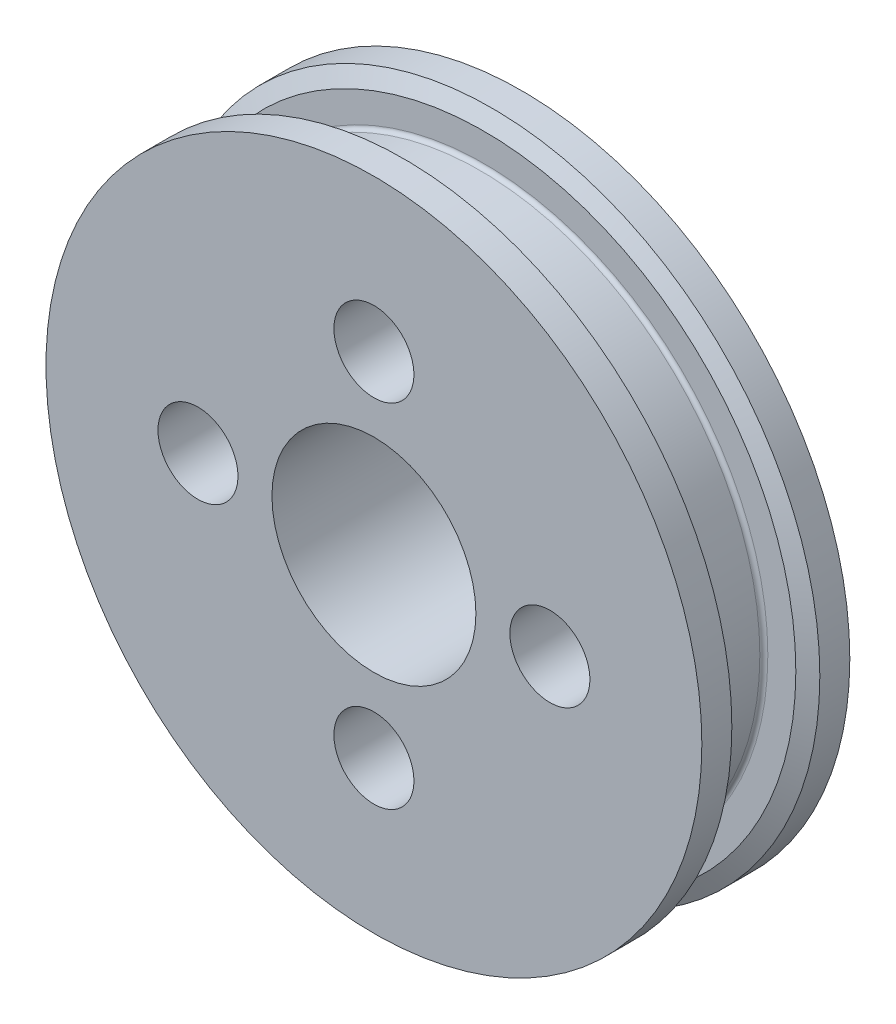
from build123d import *

# Parameters (mm, degrees)
SKETCH3_W               = 16.51
SKETCH3_H               = 16.51
SKETCH3_R               = 6.477
BOSS_EXTRUDE1_DEPTH     = 3.175
CUT_EXTRUDE1_DEPTH      = 31.918175431
CUT_EXTRUDE1_DEPTH_BACK = 31.918175431
SKETCH4_R               = 2.54
FILLET1_R               = 0.254


with BuildPart() as part:
    # Sketch2 → Revolve1 (revolve)
    with BuildSketch(Plane(origin=(0, 0, 0), x_dir=(0, 0, -1), z_dir=(1, 0, 0))):
        Polygon((0, 6.477), (0, 20.828), (1.905, 20.828), (2.413, 19.812), (2.413, 17.78), (6.985, 17.78), (6.985, 19.812), (7.493, 20.828), (9.398, 20.828), (9.398, 6.477), align=None)
    revolve(axis=Axis((0, 0, 0), (0, 0, -1)))

    # Sketch3 → Boss-Extrude1 (add)
    with BuildSketch(Plane(origin=(0, 0, -9.398), x_dir=(-1, 0, 0), z_dir=(0, 0, -1))):
        Rectangle(SKETCH3_W, SKETCH3_H)
        Circle(SKETCH3_R, mode=Mode.SUBTRACT)
    extrude(amount=BOSS_EXTRUDE1_DEPTH)

    # Sketch4 → Cut-Extrude1 (cut, two sides: drawn at the far end of the back side and taken through both)
    with BuildSketch(Plane(origin=(0, 0, -9.398), x_dir=(-1, 0, 0), z_dir=(0, 0, -1)).offset(-CUT_EXTRUDE1_DEPTH_BACK)):
        with Locations((0, 11.176)):
            Circle(SKETCH4_R)
        with Locations((11.176, 0)):
            Circle(SKETCH4_R)
        with Locations((0, -11.176)):
            Circle(SKETCH4_R)
        with Locations((-11.176, 0)):
            Circle(SKETCH4_R)
    extrude(amount=CUT_EXTRUDE1_DEPTH + CUT_EXTRUDE1_DEPTH_BACK, mode=Mode.SUBTRACT)

    # Fillet1
    fillet1_edges = [part.edges().sort_by_distance(p)[0] for p in [
        (0, -17.78, -6.985),
        (0, -17.78, -2.413),
    ]]
    fillet(fillet1_edges, radius=FILLET1_R)


solid = part.part
